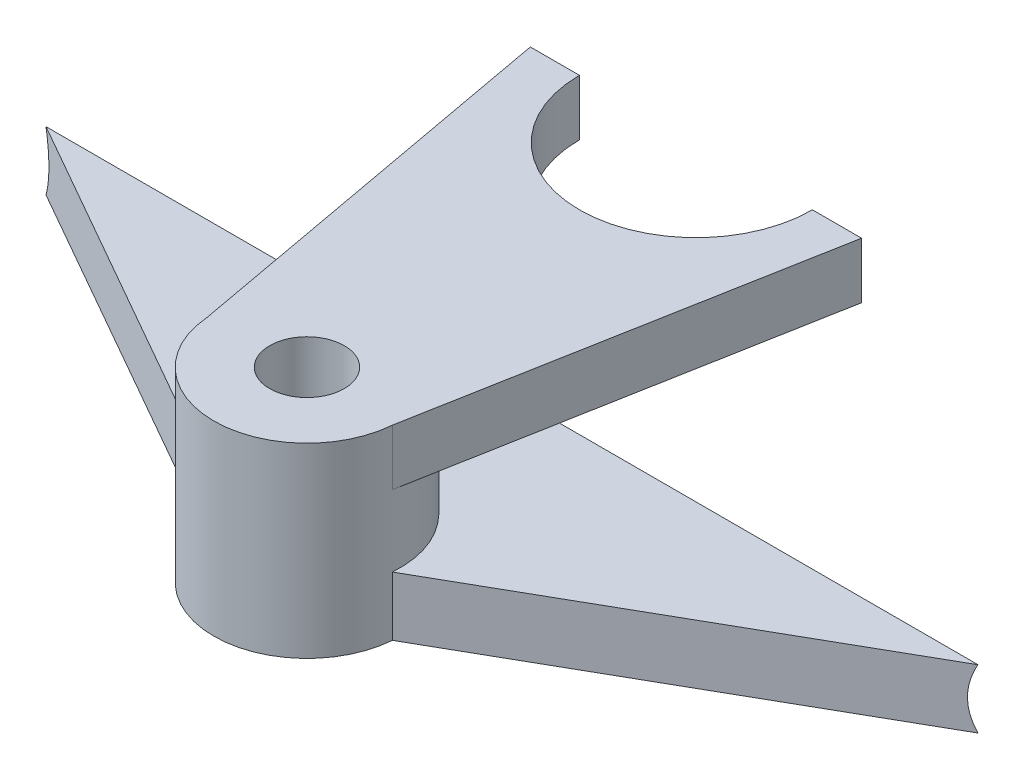
from build123d import *

# Parameters (mm, degrees)
BOSS_EXTRUDE1_DEPTH = 6.35
SKETCH1_3_R         = 4
BOSS_EXTRUDE2_DEPTH = 20
SKETCH2_R           = 12.5
CUT_EXTRUDE1_DEPTH  = 107.883113727
BOSS_EXTRUDE3_START = -6
BOSS_EXTRUDE3_DEPTH = 6


with BuildPart() as part:
    # Sketch1 → Boss-Extrude1 (new body)
    with BuildSketch(Plane(origin=(0, 0, 0), x_dir=(1, 0, 0), z_dir=(0, 1, 0))):
        with BuildLine():
            Line((100, 0), (0, 0))
            Line((0, 0), (40.032558322, -22.806291758))
            ThreePointArc((40.032558322, -22.806291758), (49.596525576, -12.008142896), (60, -22))
            ThreePointArc((60, -22), (59.991857104, -22.403474424), (59.967441678, -22.806291758))
            Line((59.967441678, -22.806291758), (100, 0))
        make_face()
    extrude(amount=BOSS_EXTRUDE1_DEPTH)

    # Sketch1<3> → Boss-Extrude2 (add)
    with BuildSketch(Plane(origin=(0, 0, 0), x_dir=(1, 0, 0), z_dir=(0, 1, 0))):
        with BuildLine():
            ThreePointArc((60, -22), (49.596525576, -12.008142896), (40.032558322, -22.806291758))
            ThreePointArc((40.032558322, -22.806291758), (50, -32), (59.967441678, -22.806291758))
            ThreePointArc((59.967441678, -22.806291758), (59.991857104, -22.403474424), (60, -22))
        make_face()
        with Locations((50, -22)):
            Circle(SKETCH1_3_R, mode=Mode.SUBTRACT)
    extrude(amount=BOSS_EXTRUDE2_DEPTH)

    # Sketch2 → Cut-Extrude1 (cut, through all)
    with BuildSketch(Plane(origin=(0, 0, 0), x_dir=(0, 0, -1), z_dir=(1, 0, 0))):
        with Locations((12.090052729, 3.175)):
            Circle(SKETCH2_R)
    extrude(amount=CUT_EXTRUDE1_DEPTH, mode=Mode.SUBTRACT)

    # Sketch3 → Boss-Extrude3 (add)
    with BuildSketch(Plane(origin=(0, 20, 0), x_dir=(1, 0, 0), z_dir=(0, 1, 0)).offset(BOSS_EXTRUDE3_START)):
        with BuildLine():
            Line((32.230008975, 19.736924161), (40.032558322, -22.806291758))
            ThreePointArc((40.032558322, -22.806291758), (50, -12), (59.967441678, -22.806291758))
            Line((59.967441678, -22.806291758), (67.769991025, 19.736924161))
            Line((67.769991025, 19.736924161), (62.5, 19.736924161))
            ThreePointArc((62.5, 19.736924161), (50, 7.236924161), (37.5, 19.736924161))
            Line((37.5, 19.736924161), (32.230008975, 19.736924161))
        make_face()
    extrude(amount=BOSS_EXTRUDE3_DEPTH)


solid = part.part
